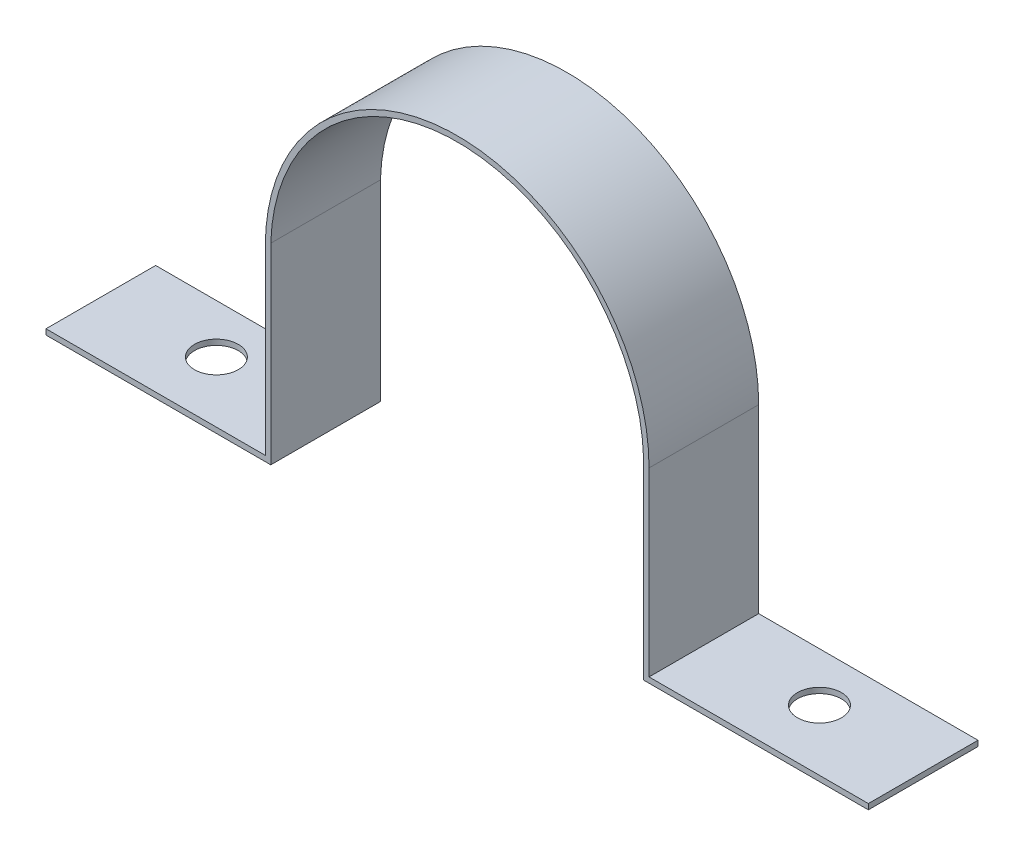
from build123d import *

# Parameters (mm, degrees)
SALIENTE_EXTRUIR1_DEPTH = 10
CROQUIS2_R              = 2
CORTAR_EXTRUIR1_DEPTH   = 10


with BuildPart() as part:
    # Croquis1 → Saliente-Extruir1 (new body)
    with BuildSketch(Plane.XY):
        with BuildLine():
            Line((-17.5, 0), (-17.5, -16.507351352))
            Line((-17.5, -16.507351352), (-37.5, -16.507351352))
            Line((-37.5, -16.507351352), (-37.5, -17.007351352))
            Line((-37.5, -17.007351352), (-17, -17.007351352))
            Line((-17, -17.007351352), (-17, 0.5))
            ThreePointArc((-17, 0.5), (0, 17.007351352), (17, 0.5))
            Line((17, 0.5), (17, -17.007351352))
            Line((17, -17.007351352), (37.5, -17.007351352))
            Line((37.5, -17.007351352), (37.5, -16.507351352))
            Line((37.5, -16.507351352), (17.5, -16.507351352))
            Line((17.5, -16.507351352), (17.5, 0))
            ThreePointArc((17.5, 0), (0, 17.5), (-17.5, 0))
        make_face()
    extrude(amount=SALIENTE_EXTRUIR1_DEPTH)

    # Croquis2 → Cortar-Extruir1 (cut)
    with BuildSketch(Plane(origin=(0, -16.507351352, 0), x_dir=(1, 0, 0), z_dir=(0, 1, 0))):
        with Locations((-27.5, -4.461447319)):
            Circle(CROQUIS2_R)
        with Locations((27.5, -4.461447319)):
            Circle(CROQUIS2_R)
    extrude(amount=-CORTAR_EXTRUIR1_DEPTH, mode=Mode.SUBTRACT)


solid = part.part
